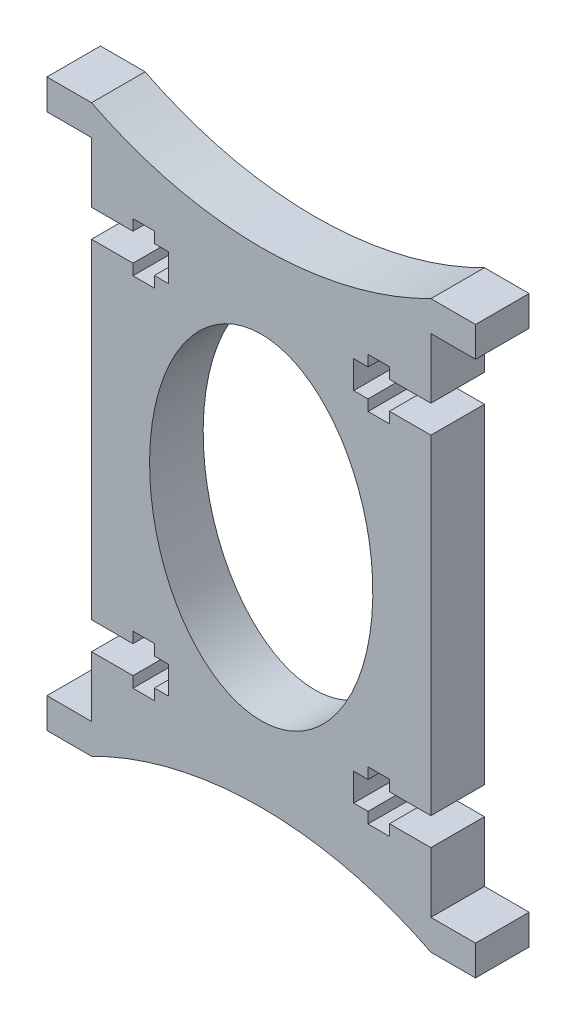
from build123d import *

# Parameters (mm, degrees)
SKETCH1_RX          = 18.75
SKETCH1_RY          = 12.5
BOSS_EXTRUDE1_DEPTH = 6


with BuildPart() as part:
    # Sketch1 → Boss-Extrude1 (new body)
    with BuildSketch(Plane.XY):
        with BuildLine():
            Line((733.480322055, 436.653824982), (735.880322055, 436.653824982))
            Line((735.880322055, 436.653824982), (735.880322055, 437.878226994))
            Line((735.880322055, 437.878226994), (740.518527083, 437.878226994))
            Line((740.518527083, 437.878226994), (740.518527083, 431.116067))
            Line((740.518527083, 431.116067), (745.518527083, 431.116067))
            Line((745.518527083, 431.116067), (745.518527083, 427.736067))
            Line((745.518527083, 427.736067), (740.518527083, 427.736067))
            ThreePointArc((740.518527083, 427.736067), (721.518527083, 432.279425399), (702.518527083, 427.736067))
            Line((702.518527083, 427.736067), (697.518527083, 427.736067))
            Line((697.518527083, 427.736067), (697.518527083, 431.116067))
            Line((697.518527083, 431.116067), (702.518527083, 431.116067))
            Line((702.518527083, 431.116067), (702.518527083, 437.878226994))
            Line((702.518527083, 437.878226994), (707.156732111, 437.878226994))
            Line((707.156732111, 437.878226994), (707.156732111, 436.653824982))
            Line((707.156732111, 436.653824982), (709.556732111, 436.653824982))
            Line((709.556732111, 436.653824982), (709.556732111, 437.878226994))
            Line((709.556732111, 437.878226994), (711.156732111, 437.878226994))
            Line((711.156732111, 437.878226994), (711.156732111, 440.973907006))
            Line((711.156732111, 440.973907006), (709.556732111, 440.973907006))
            Line((709.556732111, 440.973907006), (709.556732111, 442.198309018))
            Line((709.556732111, 442.198309018), (707.156732111, 442.198309018))
            Line((707.156732111, 442.198309018), (707.156732111, 440.973907006))
            Line((707.156732111, 440.973907006), (702.518527083, 440.973907006))
            Line((702.518527083, 440.973907006), (702.518527083, 459.426067))
            Line((702.518527083, 459.426067), (702.518527083, 477.878226994))
            Line((702.518527083, 477.878226994), (707.156732111, 477.878226994))
            Line((707.156732111, 477.878226994), (707.156732111, 476.653824982))
            Line((707.156732111, 476.653824982), (709.556732111, 476.653824982))
            Line((709.556732111, 476.653824982), (709.556732111, 477.878226994))
            Line((709.556732111, 477.878226994), (711.156732111, 477.878226994))
            Line((711.156732111, 477.878226994), (711.156732111, 480.973907006))
            Line((711.156732111, 480.973907006), (709.556732111, 480.973907006))
            Line((709.556732111, 480.973907006), (709.556732111, 482.198309018))
            Line((709.556732111, 482.198309018), (707.156732111, 482.198309018))
            Line((707.156732111, 482.198309018), (707.156732111, 480.973907006))
            Line((707.156732111, 480.973907006), (702.518527083, 480.973907006))
            Line((702.518527083, 480.973907006), (702.518527083, 487.736067))
            Line((702.518527083, 487.736067), (697.518527083, 487.736067))
            Line((697.518527083, 487.736067), (697.518527083, 491.116067))
            Line((697.518527083, 491.116067), (702.518527083, 491.116067))
            ThreePointArc((702.518527083, 491.116067), (721.518527083, 486.5727086), (740.518527083, 491.116067))
            Line((740.518527083, 491.116067), (745.518527083, 491.116067))
            Line((745.518527083, 491.116067), (745.518527083, 487.736067))
            Line((745.518527083, 487.736067), (740.518527083, 487.736067))
            Line((740.518527083, 487.736067), (740.518527083, 480.973907006))
            Line((740.518527083, 480.973907006), (735.880322055, 480.973907006))
            Line((735.880322055, 480.973907006), (735.880322055, 482.198309018))
            Line((735.880322055, 482.198309018), (733.480322055, 482.198309018))
            Line((733.480322055, 482.198309018), (733.480322055, 480.973907006))
            Line((733.480322055, 480.973907006), (731.880322055, 480.973907006))
            Line((731.880322055, 480.973907006), (731.880322055, 477.878226994))
            Line((731.880322055, 477.878226994), (733.480322055, 477.878226994))
            Line((733.480322055, 477.878226994), (733.480322055, 476.653824982))
            Line((733.480322055, 476.653824982), (735.880322055, 476.653824982))
            Line((735.880322055, 476.653824982), (735.880322055, 477.878226994))
            Line((735.880322055, 477.878226994), (740.518527083, 477.878226994))
            Line((740.518527083, 477.878226994), (740.518527083, 459.426067))
            Line((740.518527083, 459.426067), (740.518527083, 440.973907006))
            Line((740.518527083, 440.973907006), (735.880322055, 440.973907006))
            Line((735.880322055, 440.973907006), (735.880322055, 442.198309018))
            Line((735.880322055, 442.198309018), (733.480322055, 442.198309018))
            Line((733.480322055, 442.198309018), (733.480322055, 440.973907006))
            Line((733.480322055, 440.973907006), (731.880322055, 440.973907006))
            Line((731.880322055, 440.973907006), (731.880322055, 437.878226994))
            Line((731.880322055, 437.878226994), (733.480322055, 437.878226994))
            Line((733.480322055, 437.878226994), (733.480322055, 436.653824982))
        make_face()
        with Locations(Location((721.518527083, 459.426067), (0, 0, 90))):
            Ellipse(SKETCH1_RX, SKETCH1_RY, mode=Mode.SUBTRACT)
    extrude(amount=BOSS_EXTRUDE1_DEPTH)


solid = part.part
